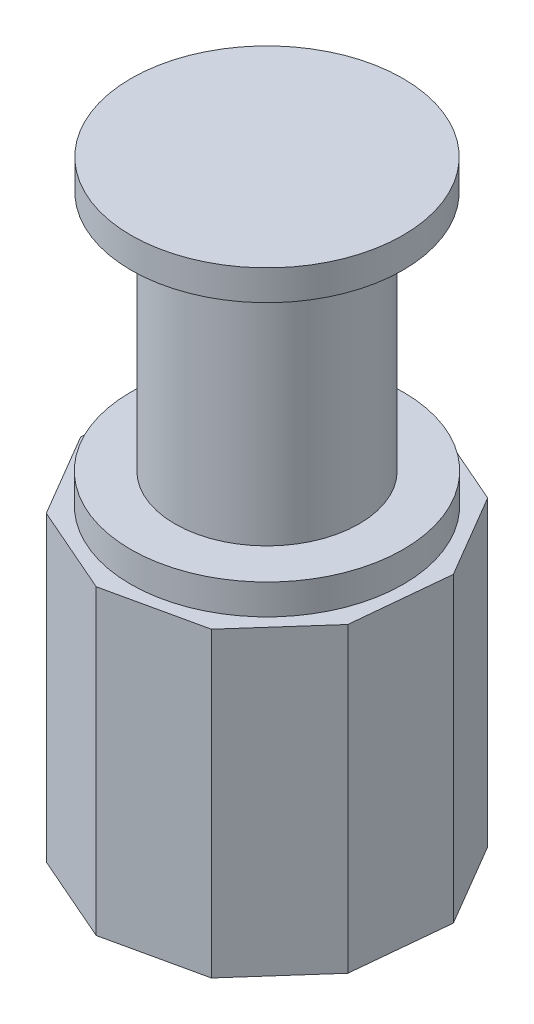
from build123d import *

# Parameters (mm, degrees)
EXTRUDE_2_DEPTH = 100


with BuildPart() as part:
    # Эскиз2 → Повернуть1 (revolve)
    with BuildSketch(Plane(origin=(0, 0, 0), x_dir=(0, 0, -1), z_dir=(1, 0, 0))):
        Polygon((0, 0), (45.117467606, 0), (45.117467606, 10), (30.484775409, 10), (30.484775409, 90), (45, 90), (45, 100), (0, 100), align=None)
    revolve(axis=Axis((0, -61.701185429, 0), (0, 1, 0)))

    # Эскиз3 → Бобышка-Вытянуть2 (add)
    with BuildSketch(Plane.XZ):
        Polygon((34.337295992, -38.729524964), (50.5440996, -11.149887693), (47.444775092, 20.688627707), (26.223159088, 44.624790503), (-5.014812396, 51.515800068), (-34.337295992, 38.729524964), (-50.5440996, 11.149887693), (-47.444775092, -20.688627707), (-26.223159088, -44.624790503), (5.014812396, -51.515800068), align=None)
    extrude(amount=EXTRUDE_2_DEPTH)


solid = part.part
